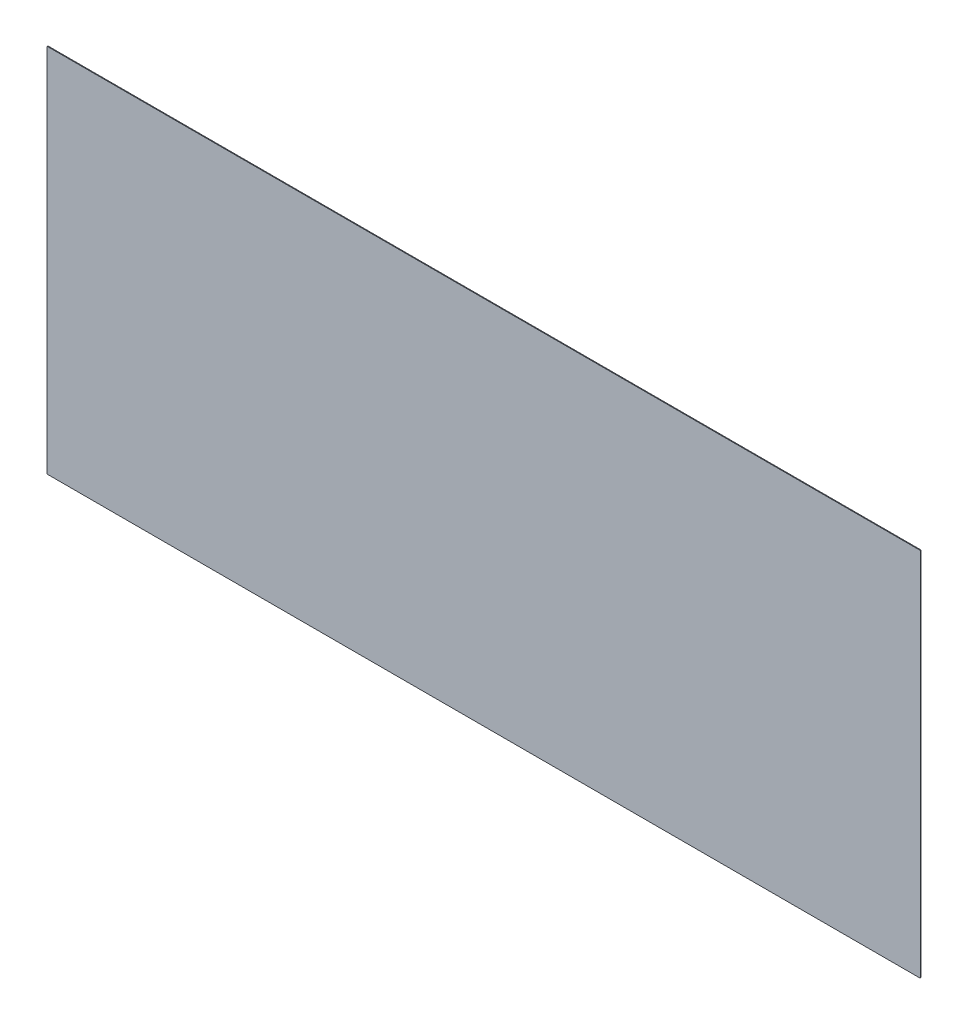
from build123d import *

# Parameters (mm, degrees)
BASE_FLANGE1_DEPTH = 1


# Sheet-metal steps are written as plain solids
with BuildPart() as part:
    # Sketch1 → Base-Flange1 (new body)
    with BuildSketch(Plane.XY):
        with BuildLine():
            Line((1, 0), (1159, 0))
            ThreePointArc((1159, 0), (1159.707106781, 0.292893219), (1160, 1))
            Line((1160, 1), (1160, 491))
            ThreePointArc((1160, 491), (1159.707106781, 491.707106781), (1159, 492))
            Line((1159, 492), (1, 492))
            ThreePointArc((1, 492), (0.292893219, 491.707106781), (0, 491))
            Line((0, 491), (0, 1))
            ThreePointArc((0, 1), (0.292893219, 0.292893219), (1, 0))
        make_face()
    extrude(amount=-BASE_FLANGE1_DEPTH)


solid = part.part
